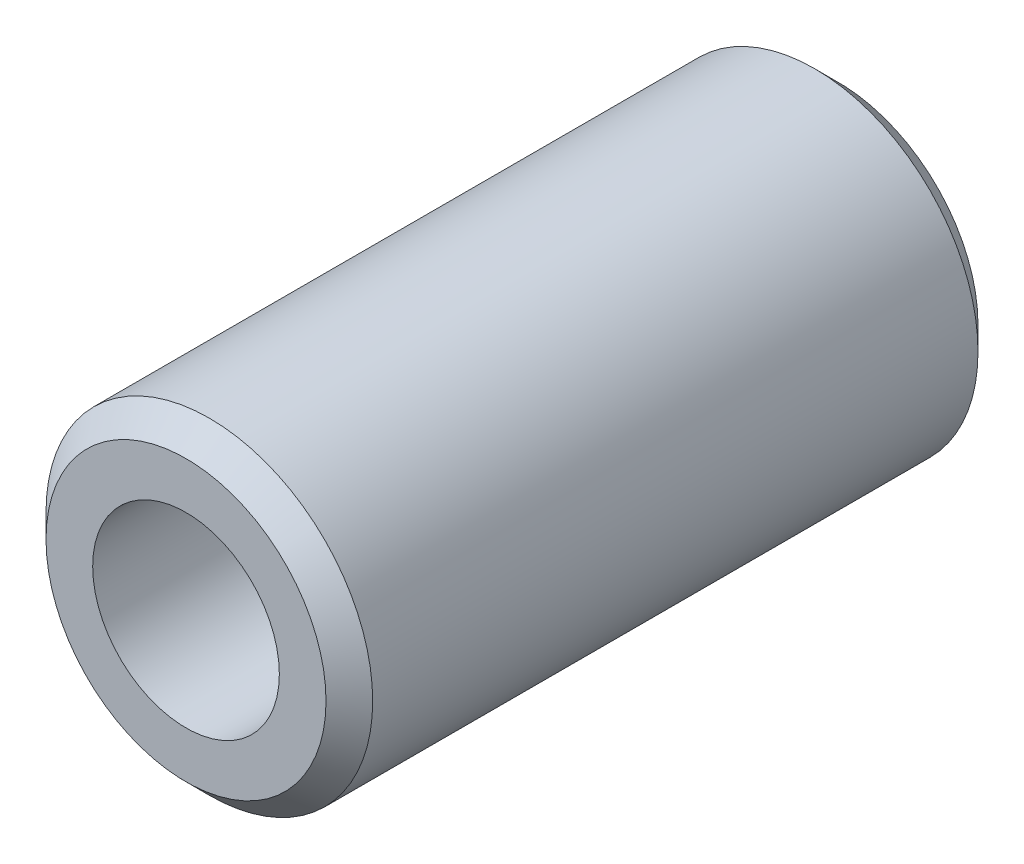
from build123d import *

# Parameters (mm, degrees)
SKETCH1_R               = 17.5
BOSS_EXTRUDE1_DEPTH     = 69.85
CUT_EXTRUDE1_DEPTH      = 75.104807536
CUT_EXTRUDE1_DEPTH_BACK = 75.104807536
SKETCH2_R               = 10
CHAMFER1_SIZE           = 2.5


with BuildPart() as part:
    # Sketch1 → Boss-Extrude1 (new body)
    with BuildSketch(Plane.XY):
        Circle(SKETCH1_R)
    extrude(amount=BOSS_EXTRUDE1_DEPTH)

    # Sketch2 → Cut-Extrude1 (cut, two sides: drawn at the far end of the back side and taken through both)
    with BuildSketch(Plane.XY.offset(69.85).offset(-CUT_EXTRUDE1_DEPTH_BACK)):
        Circle(SKETCH2_R)
    extrude(amount=CUT_EXTRUDE1_DEPTH + CUT_EXTRUDE1_DEPTH_BACK, mode=Mode.SUBTRACT)

    # Chamfer1
    chamfer1_edges = [part.edges().sort_by_distance(p)[0] for p in [
        (-17.5, 0, 69.85),
        (-17.5, 0, 0),
    ]]
    chamfer(chamfer1_edges, length=CHAMFER1_SIZE)


solid = part.part
